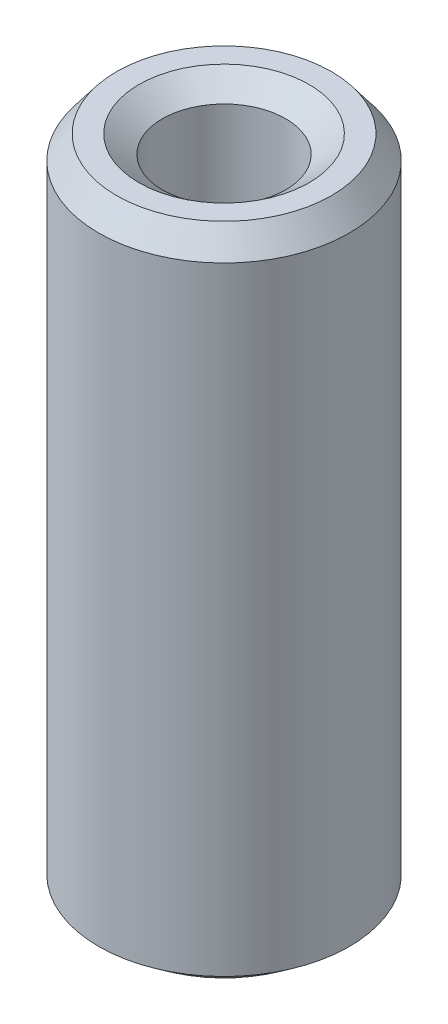
from build123d import *
from OCP.BRepFilletAPI import BRepFilletAPI_MakeChamfer

# Parameters (mm, degrees)
SKETCH1_R           = 12.5
BOSS_EXTRUDE1_DEPTH = 65.740597256
SKETCH2_R           = 6.147679954
CUT_EXTRUDE1_DEPTH  = 69.075885066
CHAMFER1_SIZE       = 2.340153226
CHAMFER1_SIZE2      = 1.78602773


with BuildPart() as part:
    # Sketch1 → Boss-Extrude1 (new body)
    with BuildSketch(Plane(origin=(0, 0, 0), x_dir=(1, 0, 0), z_dir=(0, 1, 0))):
        Circle(SKETCH1_R)
    extrude(amount=BOSS_EXTRUDE1_DEPTH)

    # Sketch2 → Cut-Extrude1 (cut, through all)
    with BuildSketch(Plane(origin=(0, 0, 0), x_dir=(1, 0, 0), z_dir=(0, 1, 0))):
        Circle(SKETCH2_R)
    extrude(amount=CUT_EXTRUDE1_DEPTH, mode=Mode.SUBTRACT)

    # Chamfer1: one chamfer whose edges measure the first distance from different faces: ONE call of the kernel's chamfer builder (chamfer() names one face for all edges)
    chamfer1_edges_1 = [part.edges().sort_by_distance(p)[0] for p in [
        (-6.147679954, 65.740597256, 0),
    ]]
    chamfer1_side_1 = [part.faces().sort_by_distance(p)[0] for p in [
        (-12.146446609, 65.740597256, 0),
    ]]
    chamfer1_edges_2 = [part.edges().sort_by_distance(p)[0] for p in [
        (-6.147679954, 0, 0),
    ]]
    chamfer1_side_2 = [part.faces().sort_by_distance(p)[0] for p in [
        (-6.147679954, 32.870298628, 0),
    ]]
    chamfer1_edges_3 = [part.edges().sort_by_distance(p)[0] for p in [
        (-12.5, 0, 0),
    ]]
    chamfer1_side_3 = [part.faces().sort_by_distance(p)[0] for p in [
        (-12.146446609, 0, 0),
    ]]
    chamfer1_edges_4 = [part.edges().sort_by_distance(p)[0] for p in [
        (-12.5, 65.740597256, 0),
    ]]
    chamfer1_side_4 = [part.faces().sort_by_distance(p)[0] for p in [
        (-12.5, 32.870298628, 0),
    ]]
    chamfer1 = BRepFilletAPI_MakeChamfer(part.part.solid().wrapped)
    for e in chamfer1_edges_1:
        chamfer1.Add(CHAMFER1_SIZE, CHAMFER1_SIZE2, e.wrapped, chamfer1_side_1[0].wrapped)  # the first distance lies on this face
    for e in chamfer1_edges_2:
        chamfer1.Add(CHAMFER1_SIZE, CHAMFER1_SIZE2, e.wrapped, chamfer1_side_2[0].wrapped)  # the first distance lies on this face
    for e in chamfer1_edges_3:
        chamfer1.Add(CHAMFER1_SIZE, CHAMFER1_SIZE2, e.wrapped, chamfer1_side_3[0].wrapped)  # the first distance lies on this face
    for e in chamfer1_edges_4:
        chamfer1.Add(CHAMFER1_SIZE, CHAMFER1_SIZE2, e.wrapped, chamfer1_side_4[0].wrapped)  # the first distance lies on this face
    add(Compound.cast(chamfer1.Shape()), mode=Mode.REPLACE)


solid = part.part
